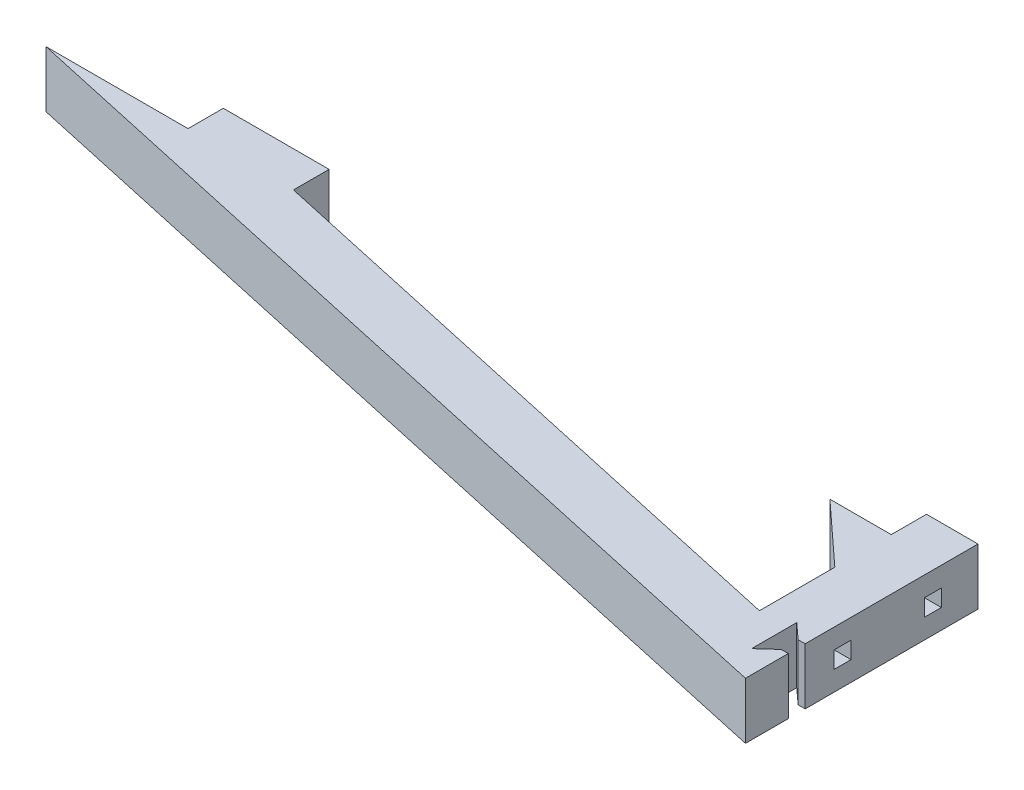
from build123d import *

# Parameters (mm, degrees)
P_IDAT_VYSUNUT_M1_DEPTH  = 8
ODEBRAT_VYSUNUT_M1_DEPTH = 132.589517946
SKICA5_W                 = 16
SKICA5_H                 = 8
P_IDAT_VYSUNUT_M2_DEPTH  = 8
ODEBRAT_VYSUNUT_M4_DEPTH = 132.589517946
SKICA4_W                 = 2.4
SKICA4_H                 = 2.4
ODEBRAT_VYSUNUT_M2_DEPTH = 4.4


with BuildPart() as part:
    # Skica2 → Přidat vysunutím1 (new body)
    with BuildSketch(Plane(origin=(0, 0, 0), x_dir=(1, 0, 0), z_dir=(0, 1, 0))):
        Polygon((0, 0), (0, -32.97), (-127.140789416, -5), (-107, -5), (-107, 0), (-92, 0), (-92, -5.051361455), (-7.3, -23.684712804), (-7.3, 0), align=None)
    extrude(amount=P_IDAT_VYSUNUT_M1_DEPTH)

    # Skica3 → Odebrat vysunutím1 (cut, through all)
    with BuildSketch(Plane(origin=(0, 8, 0), x_dir=(1, 0, 0), z_dir=(0, 1, 0))):
        Polygon((0, -24.5), (-1, -24.5), (-3.2, -22.5), (-3.2, -28.9), (-1, -26.9), (0, -26.9), align=None)
    extrude(amount=-ODEBRAT_VYSUNUT_M1_DEPTH, mode=Mode.SUBTRACT)

    # Skica5 → Přidat vysunutím2 (add)
    with BuildSketch(Plane(origin=(0, 8, 0), x_dir=(1, 0, 0), z_dir=(0, 1, 0))):
        with Locations((-8, -9)):
            Rectangle(SKICA5_W, SKICA5_H)
    extrude(amount=-P_IDAT_VYSUNUT_M2_DEPTH)

    # Skica7 → Odebrat vysunutím4 (cut, through all)
    with BuildSketch(Plane.XZ):
        Polygon((-16, 5), (-16, 13), (-7.3, 13), align=None)
    extrude(amount=-ODEBRAT_VYSUNUT_M4_DEPTH, mode=Mode.SUBTRACT)

    # Skica4 → Odebrat vysunutím2 (cut)
    with BuildSketch(Plane(origin=(0, 0, 0), x_dir=(0, 0, -1), z_dir=(1, 0, 0))):
        with Locations((-19.2, 4)):
            Rectangle(SKICA4_W, SKICA4_H)
        with Locations((-6.4, 4)):
            Rectangle(SKICA4_W, SKICA4_H)
    extrude(amount=-ODEBRAT_VYSUNUT_M2_DEPTH, mode=Mode.SUBTRACT)


solid = part.part
